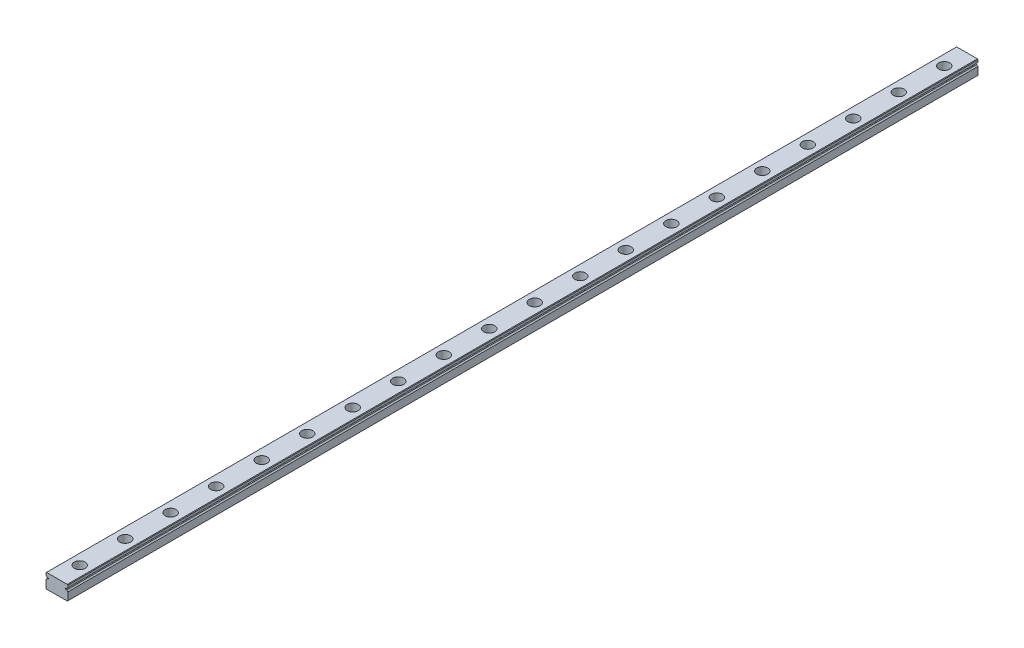
from build123d import *

# Parameters (mm, degrees)
EXTRUDE_1_DEPTH        = 500
SKETCH_2_R             = 3
SKETCH_2_R_2           = 1.75
CUT_EXTRUDE_1_DEPTH    = 4.5
SKETCH_2_2_R           = 1.75
CUT_EXTRUDE_2_DEPTH    = 501.099990002
PATTERN_LINEAR_1_COUNT = 20
PATTERN_LINEAR_1_PITCH = 25


with BuildPart() as part:
    # Эскиз1 → Бобышка-Вытянуть1 (new body)
    with BuildSketch(Plane.XY):
        with BuildLine():
            Line((-6, 3.7), (-5.7, 4))
            Line((-5.7, 4), (5.7, 4))
            Line((5.7, 4), (6, 3.7))
            Line((6, 3.7), (6, 2.451013544))
            ThreePointArc((6, 2.451013544), (5.597935912, 2.202976267), (5.354599002, 1.798050138))
            Line((5.354599002, 1.798050138), (4.643514056, 1.798050138))
            Line((4.643514056, 1.798050138), (4.643514056, 1.201949862))
            Line((4.643514056, 1.201949862), (5.354599002, 1.201949862))
            ThreePointArc((5.354599002, 1.201949862), (5.597935912, 0.797023733), (6, 0.548986456))
            Line((6, 0.548986456), (6, -3.7))
            Line((6, -3.7), (5.7, -4))
            Line((5.7, -4), (-5.7, -4))
            Line((-5.7, -4), (-6, -3.7))
            Line((-6, -3.7), (-6, 0.548986456))
            ThreePointArc((-6, 0.548986456), (-5.597935912, 0.797023733), (-5.354599002, 1.201949862))
            Line((-5.354599002, 1.201949862), (-4.643514056, 1.201949862))
            Line((-4.643514056, 1.201949862), (-4.643514056, 1.798050138))
            Line((-4.643514056, 1.798050138), (-5.354599002, 1.798050138))
            ThreePointArc((-5.354599002, 1.798050138), (-5.597935912, 2.202976267), (-6, 2.451013544))
            Line((-6, 2.451013544), (-6, 3.7))
        make_face()
    extrude(amount=EXTRUDE_1_DEPTH)

    # Эскиз2 → Вырез-Вытянуть1 (cut)
    with BuildSketch(Plane(origin=(0, 4, 0), x_dir=(1, 0, 0), z_dir=(0, 1, 0))):
        with Locations((0, -12.5)):
            Circle(SKETCH_2_R)
        with Locations((0, -12.5)):
            Circle(SKETCH_2_R_2, mode=Mode.SUBTRACT)
    cut_extrude_1 = extrude(amount=-CUT_EXTRUDE_1_DEPTH, mode=Mode.SUBTRACT)

    # Эскиз2<2> → Вырез-Вытянуть2 (cut, through all)
    with BuildSketch(Plane(origin=(0, 4, 0), x_dir=(1, 0, 0), z_dir=(0, 1, 0))):
        with Locations((0, -12.5)):
            Circle(SKETCH_2_2_R)
    cut_extrude_2 = extrude(amount=-CUT_EXTRUDE_2_DEPTH, mode=Mode.SUBTRACT)

    # Линейный массив1: Вырез-Вытянуть1, Вырез-Вытянуть2 ×20
    with Locations(*[(0, 0, i * PATTERN_LINEAR_1_PITCH) for i in range(1, PATTERN_LINEAR_1_COUNT)]):
        add(cut_extrude_1, mode=Mode.SUBTRACT)
        add(cut_extrude_2, mode=Mode.SUBTRACT)


solid = part.part
